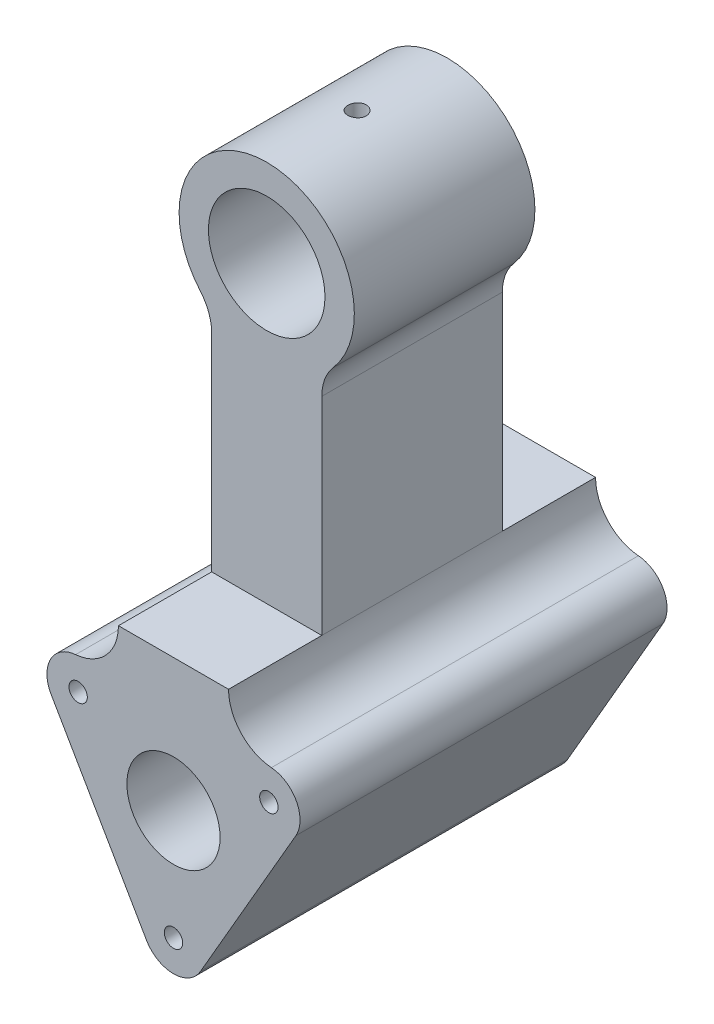
from build123d import *

# Parameters (mm, degrees)
SKETCH1_R           = 1.25
SKETCH1_R_2         = 6.35
BOSS_EXTRUDE1_DEPTH = 25
SKETCH1_3_R         = 7.9375
BOSS_EXTRUDE2_DEPTH = 12.3
SKETCH3_R           = 1.25
CUT_EXTRUDE1_DEPTH  = 84.203236869


with BuildPart() as part:
    # Sketch1 → Boss-Extrude1 (new, symmetric)
    with BuildSketch(Plane.XY):
        with BuildLine():
            ThreePointArc((-13.335039595, -46.477201725), (-16.754192728, -48.73931851), (-16.670989023, -52.838203436))
            Line((-16.670989023, -52.838203436), (-3.680607966, -75.338203436))
            ThreePointArc((-3.680607966, -75.338203436), (0, -77.463203436), (3.680607966, -75.338203436))
            Line((3.680607966, -75.338203436), (16.670989023, -52.838203436))
            ThreePointArc((16.670989023, -52.838203436), (16.754192728, -48.73931851), (13.335039595, -46.477201725))
            ThreePointArc((13.335039595, -46.477201725), (9.181354663, -44.452329952), (7.5, -40.148116816))
            Line((7.5, -40.148116816), (-7.5, -40.148116816))
            ThreePointArc((-7.5, -40.148116816), (-9.181354663, -44.452329952), (-13.335039595, -46.477201725))
        make_face()
        with Locations((0, -73.213203436)):
            Circle(SKETCH1_R, mode=Mode.SUBTRACT)
        with Locations((-12.990381057, -50.713203436)):
            Circle(SKETCH1_R, mode=Mode.SUBTRACT)
        with Locations((0, -58.213203436)):
            Circle(SKETCH1_R_2, mode=Mode.SUBTRACT)
        with Locations((12.990381057, -50.713203436)):
            Circle(SKETCH1_R, mode=Mode.SUBTRACT)
    extrude(amount=BOSS_EXTRUDE1_DEPTH, both=True)

    # Sketch1<3> → Boss-Extrude2 (add, symmetric)
    with BuildSketch(Plane.XY):
        with BuildLine():
            Line((-7.5, -11.941949433), (-7.5, -40.148116816))
            Line((-7.5, -40.148116816), (7.5, -40.148116816))
            Line((7.5, -40.148116816), (7.5, -11.941949433))
            ThreePointArc((7.5, -11.941949433), (7.897661749, -9.730124543), (9.040840738, -7.795325843))
            ThreePointArc((9.040840738, -7.795325843), (0, 11.9375), (-9.040840738, -7.795325843))
            ThreePointArc((-9.040840738, -7.795325843), (-7.897661749, -9.730124543), (-7.5, -11.941949433))
        make_face()
        Circle(SKETCH1_3_R, mode=Mode.SUBTRACT)
    extrude(amount=BOSS_EXTRUDE2_DEPTH, both=True)

    # Sketch3 → Cut-Extrude1 (cut, through all)
    with BuildSketch(Plane(origin=(0, 0, 0), x_dir=(1, 0, 0), z_dir=(0, 1, 0))):
        Circle(SKETCH3_R)
    extrude(amount=CUT_EXTRUDE1_DEPTH, mode=Mode.SUBTRACT)


solid = part.part
